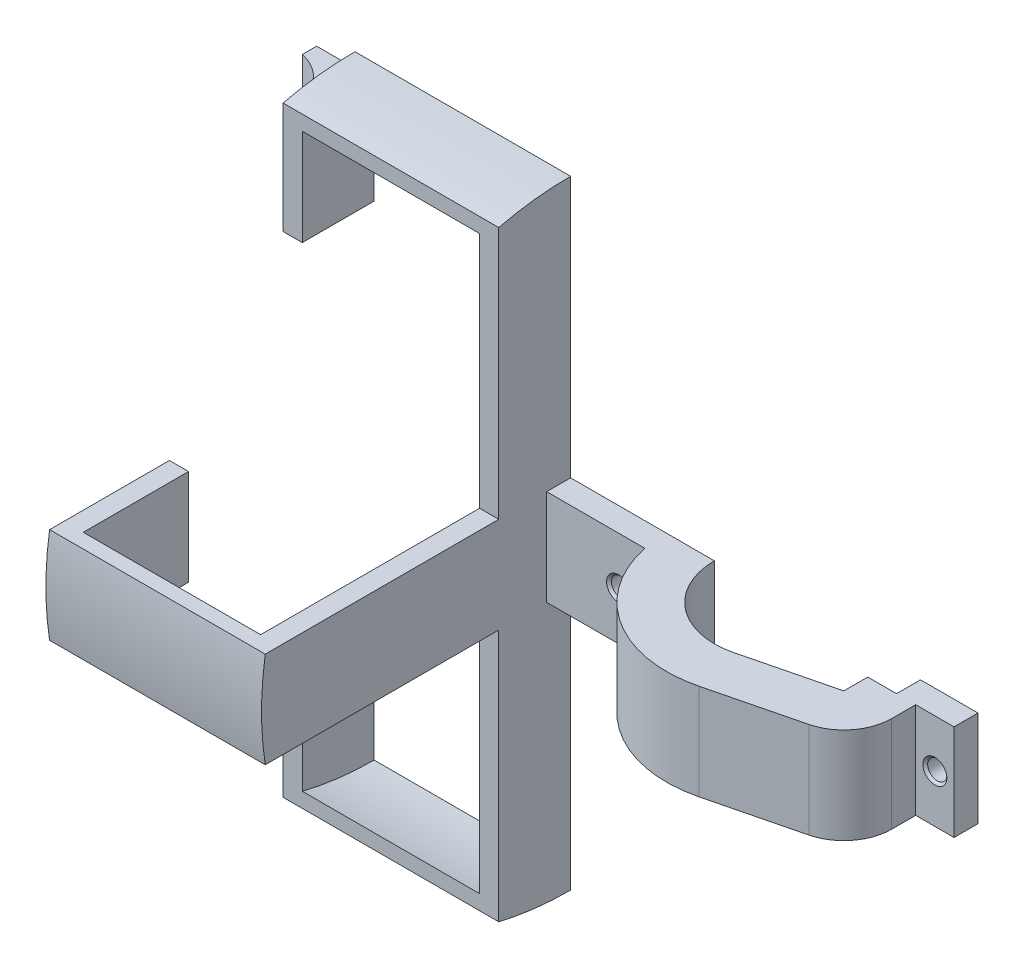
from build123d import *

# Parameters (mm, degrees)
EXTRUDE_1_DEPTH          = 20
SKETCH_2_W               = 6
SKETCH_2_H               = 10
CUT_EXTRUDE_1_DEPTH      = 20
EXTRUDE_2_DEPTH          = 5
EXTRUDE_2_DEPTH_BACK     = 5
SKETCH_3_W               = 8
SKETCH_3_H               = 20
EXTRUDE_3_DEPTH          = 5
EXTRUDE_3_DEPTH_BACK     = 5
SKETCH_4_W               = 20
SKETCH_4_H               = 20
CUT_EXTRUDE_2_DEPTH      = 52.23475383
CUT_EXTRUDE_2_DEPTH_BACK = 52.23475383
SKETCH_5_W               = 80.386179801
SKETCH_5_H               = 26.605581219
SKETCH_6_R               = 2
CUT_EXTRUDE_3_DEPTH      = 49.989794856
CHAMFER_1_SIZE           = 0.5
FILLET_1_R               = 10
SKETCH_7_W               = 5
SKETCH_7_H               = 20
EXTRUDE_4_DEPTH          = 10
SKETCH_8_R               = 64.5
EXTRUDE_5_DEPTH          = 4
SKETCH_9_W               = 60
SKETCH_9_H               = 60
SKETCH_9_W_2             = 85.907763787
SKETCH_9_H_2             = 140
CUT_EXTRUDE_4_DEPTH      = 5
EXTRUDE_8_DEPTH          = 37
EXTRUDE_9_DEPTH          = 4
SKETCH_15_W              = 8
SKETCH_15_H              = 10
EXTRUDE_10_DEPTH         = 3
SKETCH_16_R              = 2
CUT_EXTRUDE_5_DEPTH      = 3
FILLET_START             = -51.5
FILLET_2_DEPTH           = 2.999999733
FILLET_START_2           = 61.5
FILLET_2_2_DEPTH         = 2.999999733
FILLET_START_3           = -44.499993891
FILLET_2_3_DEPTH         = 2.999993891
FILLET_START_4           = 68.500006109
FILLET_2_4_DEPTH         = 2.999993891
FILLET_START_5           = -48.500000267
FILLET_2_5_DEPTH         = 4.000006376
FILLET_START_6           = 64.499999733
FILLET_2_6_DEPTH         = 4.000006376
FILLET_START_7           = 3
FILLET_2_7_OUTLINE_R     = 2
FILLET_2_7_DEPTH         = 3.797947653


with BuildPart() as part:
    # 草图1 → 凸台-拉伸1 (new body)
    with BuildSketch(Plane(origin=(0, 0, 0), x_dir=(1, 0, 0), z_dir=(0, 1, 0))):
        with BuildLine():
            Line((32, 17.82359333), (32, -17.82359333))
            Line((32, -17.82359333), (6.015712619, -24.265432238))
            ThreePointArc((6.015712619, -24.265432238), (-25, 0), (6.015712619, 24.265432238))
            Line((6.015712619, 24.265432238), (32, 17.82359333))
        make_face()
        with BuildLine():
            Line((22, 10), (22, -10))
            Line((22, -10), (3.609427572, -14.559259343))
            ThreePointArc((3.609427572, -14.559259343), (-15, 0), (3.609427572, 14.559259343))
            Line((3.609427572, 14.559259343), (22, 10))
        make_face(mode=Mode.SUBTRACT)
    extrude(amount=EXTRUDE_1_DEPTH)

    # 草图2 → 切除-拉伸1 (cut)
    with BuildSketch(Plane(origin=(0, 20, 0), x_dir=(1, 0, 0), z_dir=(0, 1, 0))):
        with Locations((25, 0)):
            Rectangle(SKETCH_2_W, SKETCH_2_H)
    extrude(amount=-CUT_EXTRUDE_1_DEPTH, mode=Mode.SUBTRACT)

    # 草图3 → 凸台-拉伸2 (add, two sides: drawn at the far end of the back side and taken through both)
    with BuildSketch(Plane.XY.offset(-EXTRUDE_2_DEPTH_BACK)):
        with Locations((36, 10)):
            Rectangle(SKETCH_3_W, SKETCH_3_H)
    extrude(amount=EXTRUDE_2_DEPTH + EXTRUDE_2_DEPTH_BACK)

    # 草图4 → 凸台-拉伸3 (add, two sides: drawn at the far end of the back side and taken through both)
    with BuildSketch(Plane.XY.offset(-EXTRUDE_3_DEPTH_BACK)):
        with Locations((-25, 10)):
            Rectangle(SKETCH_4_W, SKETCH_4_H)
    extrude(amount=EXTRUDE_3_DEPTH + EXTRUDE_3_DEPTH_BACK)

    # 草图5 → 切除-拉伸2 (cut, two sides: drawn at the far end of the back side and taken through both)
    with BuildSketch(Plane(origin=(0, 20, 0), x_dir=(1, 0, 0), z_dir=(0, 1, 0)).offset(-CUT_EXTRUDE_2_DEPTH_BACK)):
        with Locations((-0.193089901, 13.30279061)):
            Rectangle(SKETCH_5_W, SKETCH_5_H)
    extrude(amount=CUT_EXTRUDE_2_DEPTH + CUT_EXTRUDE_2_DEPTH_BACK, mode=Mode.SUBTRACT)

    # 草图6 → 切除-拉伸3 (cut, through all)
    with BuildSketch(Plane.XY.offset(5)):
        with Locations((-30, 10)):
            Circle(SKETCH_6_R)
        with Locations((36, 10)):
            Circle(SKETCH_6_R)
    extrude(amount=-CUT_EXTRUDE_3_DEPTH, mode=Mode.SUBTRACT)

    # 倒角1
    chamfer_1_edges = [part.edges().sort_by_distance(p)[0] for p in [
        (-32, 10, 5),
        (34, 10, 5),
    ]]
    chamfer(chamfer_1_edges, length=CHAMFER_1_SIZE)

    # 圆角1
    fillet_1_edges = [part.edges().sort_by_distance(p)[0] for p in [
        (32, 10, 17.82359333),
    ]]
    fillet(fillet_1_edges, radius=FILLET_1_R)

    # 草图7 → 凸台-拉伸4 (add)
    with BuildSketch(Plane.ZY.offset(35)):
        with Locations((2.5, 10)):
            Rectangle(SKETCH_7_W, SKETCH_7_H)
    extrude(amount=EXTRUDE_4_DEPTH)

    # 草图8 → 凸台-拉伸5 (add)
    with BuildSketch(Plane.ZY.offset(45)):
        with Locations((0, 10)):
            Circle(SKETCH_8_R)
    extrude(amount=EXTRUDE_5_DEPTH)

    # 草图9 → 切除-拉伸4 (cut)
    with BuildSketch(Plane(origin=(-45, 0, 0), x_dir=(0, 0, -1), z_dir=(1, 0, 0))):
        with Locations((-45, 50)):
            Rectangle(SKETCH_9_W, SKETCH_9_H)
        with Locations((-45, -30)):
            Rectangle(SKETCH_9_W, SKETCH_9_H)
        with Locations((42.953881894, 10)):
            Rectangle(SKETCH_9_W_2, SKETCH_9_H_2)
    extrude(amount=-CUT_EXTRUDE_4_DEPTH, mode=Mode.SUBTRACT)

    # 草图11 → 凸台-拉伸8 (add)
    with BuildSketch(Plane.ZY.offset(49)):
        with BuildLine():
            ThreePointArc((60.681545794, 20), (61.5, 10), (60.681545794, 0))
            Line((60.681545794, 0), (63.720091023, 0))
            ThreePointArc((63.720091023, 0), (64.5, 10), (63.720091023, 20))
            Line((63.720091023, 20), (60.681545794, 20))
        make_face()
        with BuildLine():
            Line((0, 74.5), (0, 71.5))
            ThreePointArc((0, 71.5), (7.557274891, 71.0339053), (15, 69.642686056))
            Line((15, 69.642686056), (15, 72.731570999))
            ThreePointArc((15, 72.731570999), (7.551942484, 74.05636709), (0, 74.5))
        make_face()
        with BuildLine():
            ThreePointArc((15, -49.642686056), (7.557274891, -51.0339053), (0, -51.5))
            Line((0, -51.5), (0, -54.5))
            ThreePointArc((0, -54.5), (7.551942484, -54.05636709), (15, -52.731570999))
            Line((15, -52.731570999), (15, -49.642686056))
        make_face()
    extrude(amount=EXTRUDE_8_DEPTH)

    # 草图13 → 凸台-拉伸9 (add)
    with BuildSketch(Plane.ZY.offset(86)):
        with BuildLine():
            Line((63.720091023, 20), (38.720091023, 20))
            Line((38.720091023, 20), (38.720091023, 0))
            Line((38.720091023, 0), (63.720091023, 0))
            ThreePointArc((63.720091023, 0), (64.5, 10), (63.720091023, 20))
        make_face()
        with BuildLine():
            Line((0, -54.5), (0, -27.731570999))
            Line((0, -27.731570999), (15, -27.731570999))
            Line((15, -27.731570999), (15, -52.731570999))
            ThreePointArc((15, -52.731570999), (7.551942484, -54.05636709), (0, -54.5))
        make_face()
        with BuildLine():
            Line((0, 74.5), (0, 49.5))
            Line((0, 49.5), (15, 49.5))
            Line((15, 49.5), (15, 72.731570999))
            ThreePointArc((15, 72.731570999), (7.551942484, 74.05636709), (0, 74.5))
        make_face()
    extrude(amount=EXTRUDE_9_DEPTH)

    # 草图15 → 凸台-拉伸10 (add)
    with BuildSketch(Plane(origin=(0, 0, 0), x_dir=(-1, 0, 0), z_dir=(0, 0, -1))):
        with Locations((94, 66.5)):
            Rectangle(SKETCH_15_W, SKETCH_15_H)
        with Locations((94, -46.5)):
            Rectangle(SKETCH_15_W, SKETCH_15_H)
    extrude(amount=-EXTRUDE_10_DEPTH)

    # 草图16 → 切除-拉伸5 (cut)
    with BuildSketch(Plane.XY.offset(3)):
        with Locations((-94, 66.5)):
            Circle(SKETCH_16_R)
        with Locations((-94, -46.5)):
            Circle(SKETCH_16_R)
    extrude(amount=-CUT_EXTRUDE_5_DEPTH, mode=Mode.SUBTRACT)

    # 圆角2: read off the stored shape, not the designer's step
    # 圆角2 outline → 圆角2 (add)
    with BuildSketch(Plane(origin=(0, 0, 0), x_dir=(1, 0, 0), z_dir=(0, 1, 0)).offset(FILLET_START)):
        with BuildLine():
            ThreePointArc((-98, -3), (-92.254033308, -6.473403651), (-90, -12.797958971))
            Line((-90, -12.797958971), (-90, -3))
            Line((-90, -3), (-98, -3))
        make_face()
    extrude(amount=FILLET_2_DEPTH)

    # Fillet 2 2 outline → Fillet 2 2 (add)
    with BuildSketch(Plane(origin=(0, 0, 0), x_dir=(1, 0, 0), z_dir=(0, 1, 0)).offset(FILLET_START_2)):
        with BuildLine():
            ThreePointArc((-98, -3), (-92.254033308, -6.473403651), (-90, -12.797958971))
            Line((-90, -12.797958971), (-90, -3))
            Line((-90, -3), (-98, -3))
        make_face()
    extrude(amount=FILLET_2_2_DEPTH)

    # Fillet 2 3 outline → Fillet 2 3 (add)
    with BuildSketch(Plane(origin=(0, 0, 0), x_dir=(1, 0, 0), z_dir=(0, 1, 0)).offset(FILLET_START_3)):
        with BuildLine():
            ThreePointArc((-98, -3), (-92.254033308, -6.473403651), (-90, -12.797958971))
            Line((-90, -12.797958971), (-90, -3))
            Line((-90, -3), (-98, -3))
        make_face()
    extrude(amount=FILLET_2_3_DEPTH)

    # Fillet 2 4 outline → Fillet 2 4 (add)
    with BuildSketch(Plane(origin=(0, 0, 0), x_dir=(1, 0, 0), z_dir=(0, 1, 0)).offset(FILLET_START_4)):
        with BuildLine():
            ThreePointArc((-98, -3), (-92.254033308, -6.473403651), (-90, -12.797958971))
            Line((-90, -12.797958971), (-90, -3))
            Line((-90, -3), (-98, -3))
        make_face()
    extrude(amount=FILLET_2_4_DEPTH)

    # Fillet 2 5 outline → Fillet 2 5 (add)
    with BuildSketch(Plane(origin=(0, 0, 0), x_dir=(1, 0, 0), z_dir=(0, 1, 0)).offset(FILLET_START_5)):
        with BuildLine():
            ThreePointArc((-98, -3), (-92.254033308, -6.473403651), (-90, -12.797958971))
            Line((-90, -12.797958971), (-90, -3))
            Line((-90, -3), (-98, -3))
        make_face()
    extrude(amount=FILLET_2_5_DEPTH)

    # Fillet 2 6 outline → Fillet 2 6 (add)
    with BuildSketch(Plane(origin=(0, 0, 0), x_dir=(1, 0, 0), z_dir=(0, 1, 0)).offset(FILLET_START_6)):
        with BuildLine():
            ThreePointArc((-98, -3), (-92.254033308, -6.473403651), (-90, -12.797958971))
            Line((-90, -12.797958971), (-90, -3))
            Line((-90, -3), (-98, -3))
        make_face()
    extrude(amount=FILLET_2_6_DEPTH)

    # Fillet 2 7 outline → Fillet 2 7 (cut)
    with BuildSketch(Plane.XY.offset(FILLET_START_7)):
        with Locations((-94, 66.5)):
            Circle(FILLET_2_7_OUTLINE_R)
        with Locations((-94, -46.5)):
            Circle(FILLET_2_7_OUTLINE_R)
    extrude(amount=FILLET_2_7_DEPTH, mode=Mode.SUBTRACT)


solid = part.part
